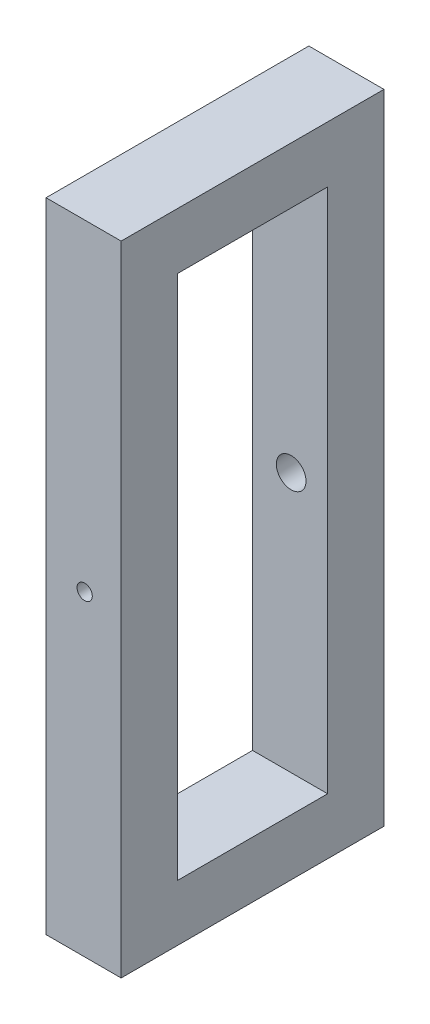
from build123d import *

# Parameters (mm, degrees)
SKETCH1_W           = 70
SKETCH1_H           = 170
SKETCH1_W_2         = 40
SKETCH1_H_2         = 140
BOSS_EXTRUDE1_DEPTH = 20


# Read off the part's stored shape, not the designer's step: Hole1
with BuildPart() as part:
    # Sketch1 → Boss-Extrude1 (new body)
    with BuildSketch(Plane(origin=(0, 0, 0), x_dir=(0, 0, -1), z_dir=(1, 0, 0))):
        Rectangle(SKETCH1_W, SKETCH1_H)
        Rectangle(SKETCH1_W_2, SKETCH1_H_2, mode=Mode.SUBTRACT)
    extrude(amount=BOSS_EXTRUDE1_DEPTH)

    # Hole1 outline → Hole1 (revolve, cut)
    with BuildSketch(Plane(origin=(10.287047222, -0.784426919, 0), x_dir=(1, 0, 0), z_dir=(0, -1, 0))):
        Polygon((0, 20), (2.555546136, 20), (2.031734593, 35), (0, 35), align=None)
        Polygon((3.952376915, -20), (0, -20), (0, -35), (4.476188458, -35), align=None)
    revolve(axis=Axis((10.287047222, -0.784426919, 0), (0, 0, 1)), mode=Mode.SUBTRACT)


solid = part.part
